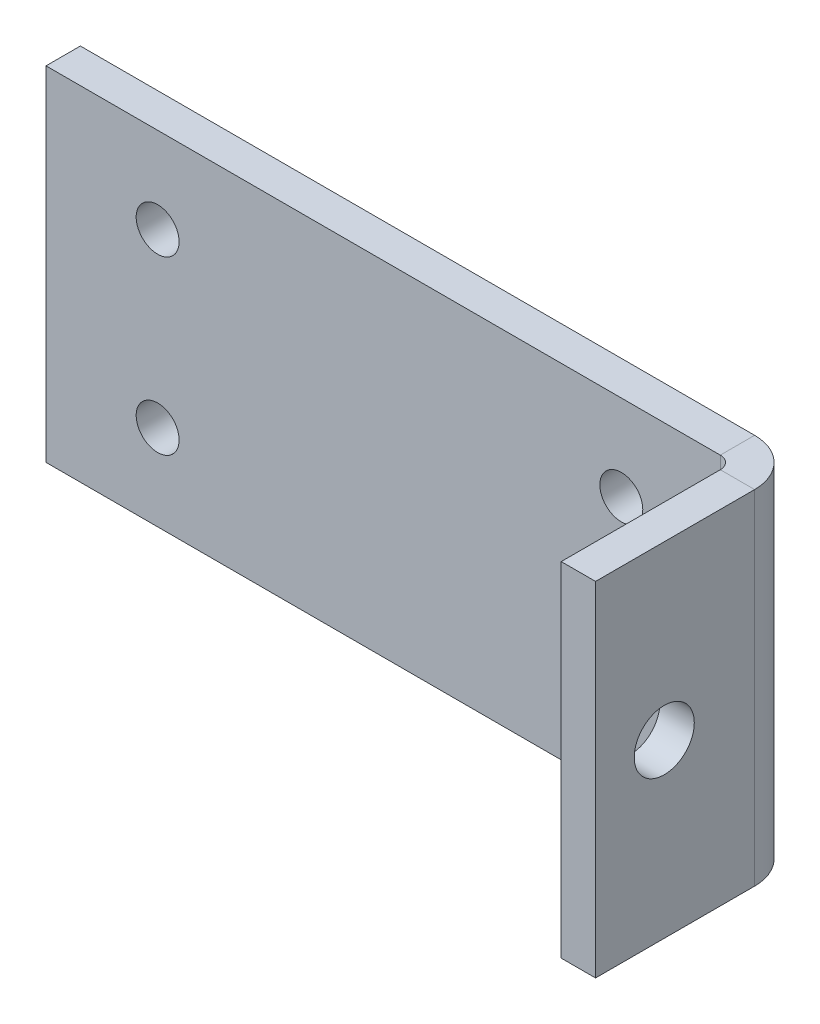
from build123d import *

# Parameters (mm, degrees)
SKETCH_1_W                       = 40
SKETCH_1_H                       = 20
SM_BASE_FLANGE_1_DEPTH           = 2
SM_EDGE_FLANGE_1_STRIP_W         = 9.4732
SM_EDGE_FLANGE_1_STRIP_H         = 2
SM_EDGE_FLANGE_1_STRIP_CUT_DEPTH = 20
SM_EDGE_FLANGE_1_DEPTH           = 20
HOLE_WIZARD_M3_2_D               = 2.5
HOLE_WIZARD_3_5_3_5_2_D          = 3.5


# Sheet-metal steps are written as plain solids
with BuildPart() as part:
    # Sketch 1 → 基材-凸緣1 (new body)
    with BuildSketch(Plane.XY):
        Rectangle(SKETCH_1_W, SKETCH_1_H)
    extrude(amount=-SM_BASE_FLANGE_1_DEPTH)

    # 邊線-凸緣1 strip (across the edge) → 邊線-凸緣1 strip cut (cut)
    with BuildSketch(Plane(origin=(20, -10, 0), x_dir=(-1, 0, 0), z_dir=(0, 1, 0))):
        with Locations((-4, -1)):
            Rectangle(SM_EDGE_FLANGE_1_STRIP_W, SM_EDGE_FLANGE_1_STRIP_H)
    extrude(amount=SM_EDGE_FLANGE_1_STRIP_CUT_DEPTH, mode=Mode.SUBTRACT)

    # 邊線-凸緣1 section (across the edge) → 邊線-凸緣1 (add)
    with BuildSketch(Plane(origin=(20, -10, 0), x_dir=(-1, 0, 0), z_dir=(0, 1, 0))):
        with BuildLine():
            Line((-2, 0.7366), (-2, 10))
            Line((-2, 10), (0, 10))
            Line((0, 10), (0, 0.7366))
            ThreePointArc((0, 0.7366), (0.215745145, 0.215745145), (0.7366, 0))
            Line((0.7366, 0), (0.7366, -2))
            ThreePointArc((0.7366, -2), (-1.198468417, -1.198468417), (-2, 0.7366))
        make_face()
    extrude(amount=SM_EDGE_FLANGE_1_DEPTH)

    # M3 螺紋孔2 (through all)
    with Locations(Plane.XY):
        with Locations((-13.5, -5), (13.5, -5), (13.5, 5), (-13.5, 5)):
            Hole(HOLE_WIZARD_M3_2_D / 2)

    # Ø3.5 (3.5) 直徑孔2 (through all)
    with Locations(Plane(origin=(22, 0, 0), x_dir=(0, 0, -1), z_dir=(1, 0, 0))):
        with Locations((-6, 0)):
            Hole(HOLE_WIZARD_3_5_3_5_2_D / 2)


solid = part.part
